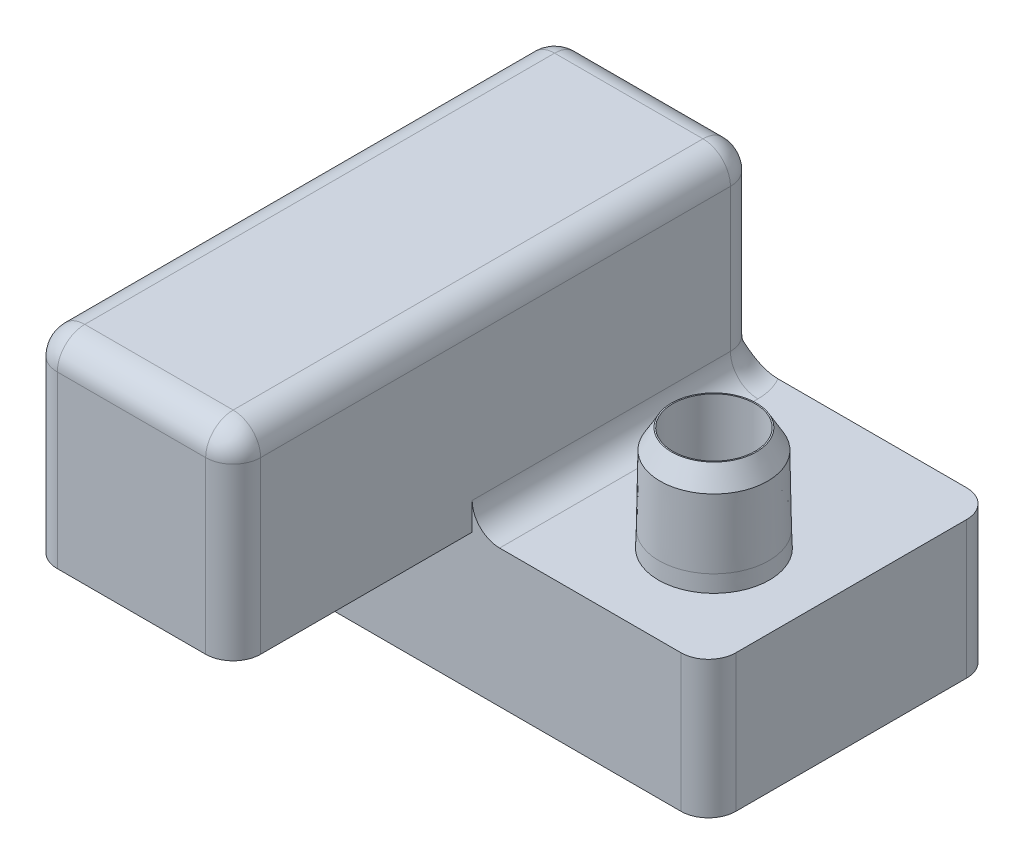
from build123d import *

# Parameters (mm, degrees)
SKETCH1_W               = 8
SKETCH1_H               = 5.2
SKETCH1_W_2             = 6.8
SKETCH1_H_2             = 4
BOSS_EXTRUDE1_DEPTH     = 2.5
SKETCH3_W               = 3.7
SKETCH3_H               = 9.55
SKETCH3_W_2             = 2.5
SKETCH3_H_2             = 8.35
BOSS_EXTRUDE2_DEPTH     = 3
SKETCH4_W               = 3.7
SKETCH4_H               = 4.95
BOSS_EXTRUDE3_DEPTH     = 0.6
SKETCH5_W               = 3.7
SKETCH5_H               = 9.55
BOSS_EXTRUDE4_DEPTH     = 0.6
SKETCH6_W               = 4.9
SKETCH6_H               = 5.2
BOSS_EXTRUDE5_DEPTH     = 0.6
FILLET2_R               = 0.7
SKETCH7_R               = 1
CUT_EXTRUDE1_DEPTH      = 4.5
CUT_EXTRUDE1_DRAFT      = -20
CUT_EXTRUDE3_REACH      = 10.671
SKETCH7_2_R             = 1
BOSS_EXTRUDE6_START     = -0.3
SKETCH8_R               = 1
BOSS_EXTRUDE6_DEPTH     = 1.6
BOSS_EXTRUDE6_DRAFT     = -1
CUT_EXTRUDE2_DEPTH      = 10.146720724
CUT_EXTRUDE2_DEPTH_BACK = 10.146720724
SKETCH9_R               = 0.75
FILLET3_R               = 0.5
FILLET5_R               = 0.5
FILLET6_R               = 0.5
CHAMFER1_SIZE           = 0.5
CHAMFER2_SIZE           = 0.2
CHAMFER2_SIZE2          = 0.357264117


# Read off the part's stored shape, not the designer's step: Boss-Extrude7
with BuildPart() as part:
    # Sketch1 → Boss-Extrude1 (new body)
    with BuildSketch(Plane(origin=(0, 0, 0), x_dir=(1, 0, 0), z_dir=(0, 1, 0))):
        Rectangle(SKETCH1_W, SKETCH1_H)
        Rectangle(SKETCH1_W_2, SKETCH1_H_2, mode=Mode.SUBTRACT)
    extrude(amount=BOSS_EXTRUDE1_DEPTH)

    # Sketch3 → Boss-Extrude2 (add)
    with BuildSketch(Plane(origin=(0, 2.5, 0), x_dir=(1, 0, 0), z_dir=(0, 1, 0))):
        with Locations((-2.15, -2.175)):
            Rectangle(SKETCH3_W, SKETCH3_H)
        with Locations((-2.15, -2.175)):
            Rectangle(SKETCH3_W_2, SKETCH3_H_2, mode=Mode.SUBTRACT)
    extrude(amount=BOSS_EXTRUDE2_DEPTH)

    # Sketch4 → Boss-Extrude3 (add)
    with BuildSketch(Plane.XZ.offset(-2.5)):
        with Locations((-2.15, 4.475)):
            Rectangle(SKETCH4_W, SKETCH4_H)
    extrude(amount=-BOSS_EXTRUDE3_DEPTH)

    # Sketch5 → Boss-Extrude4 (add)
    with BuildSketch(Plane(origin=(0, 5.5, 0), x_dir=(1, 0, 0), z_dir=(0, 1, 0))):
        with Locations((-2.15, -2.175)):
            Rectangle(SKETCH5_W, SKETCH5_H)
    extrude(amount=BOSS_EXTRUDE4_DEPTH)

    # Sketch6 → Boss-Extrude5 (add)
    with BuildSketch(Plane(origin=(0, 2.5, 0), x_dir=(1, 0, 0), z_dir=(0, 1, 0))):
        with Locations((1.55, 0)):
            Rectangle(SKETCH6_W, SKETCH6_H)
    extrude(amount=-BOSS_EXTRUDE5_DEPTH)

    # Fillet2
    fillet2_edges = [part.edges().sort_by_distance(p)[0] for p in [
        (-2.15, 5.5, -2),
        (-0.9, 5.5, 2.175),
        (-2.15, 5.5, 6.35),
        (-3.4, 5.5, 2.175),
    ]]
    fillet(fillet2_edges, radius=FILLET2_R)


with BuildPart() as cut_extrude1_tool:
    # Sketch7 → Cut-Extrude1 (with draft: the straight prism first)
    with BuildSketch(Plane.XZ.offset(-2.8)):
        with Locations((-2.15, 5.35)):
            Circle(SKETCH7_R)
    extrude(amount=CUT_EXTRUDE1_DEPTH)
    # Cut-Extrude1: the draft: its side faces are tilted about the plane it starts from
    cut_extrude1_sides = [cut_extrude1_tool.faces().sort_by_distance(p)[0] for p in [
        (-3.15, 0.55, 5.35),
    ]]
    draft(cut_extrude1_sides, Plane.XZ.offset(-2.8), CUT_EXTRUDE1_DRAFT)


with BuildPart() as part_1:
    add(part.part)

    # Cut-Extrude1: cut by cut_extrude1_tool
    add(cut_extrude1_tool.part, mode=Mode.SUBTRACT)

    # Sketch7<2> → Cut-Extrude3 (cut, up to next)
    with BuildSketch(Plane.XZ.offset(-2.8), mode=Mode.PRIVATE) as cut_extrude3_sk1:
        with Locations(Location((-2.15, 5.35, 0), (0, 0, 270))):
            Circle(SKETCH7_2_R)
    cut_extrude3_tool1 = extrude(cut_extrude3_sk1.sketch, amount=-CUT_EXTRUDE3_REACH, mode=Mode.PRIVATE) & part_1.part
    add(cut_extrude3_tool1.solids().sort_by_distance((-2.15, 2.8, 5.35))[0], mode=Mode.SUBTRACT)



with BuildPart() as body_2:
    # Sketch8 → Boss-Extrude6 (with draft: the straight prism first)
    with BuildSketch(Plane(origin=(0, 2.5, 0), x_dir=(-1, 0, 0), z_dir=(0, -1, 0)).offset(BOSS_EXTRUDE6_START)):
        with Locations((-2.15, -0.65)):
            Circle(SKETCH8_R)
    extrude(amount=-BOSS_EXTRUDE6_DEPTH)
    # Boss-Extrude6: the draft: its side faces are tilted about the plane it starts from
    boss_extrude6_sides = [body_2.faces().sort_by_distance(p)[0] for p in [
        (3.15, 3.6, 0.65),
    ]]
    draft(boss_extrude6_sides, Plane(origin=(0, 2.5, 0), x_dir=(-1, 0, 0), z_dir=(0, -1, 0)).offset(BOSS_EXTRUDE6_START), BOSS_EXTRUDE6_DRAFT)


with BuildPart() as part_2:
    add(part_1.part)

    add(body_2.part)  # Boss-Extrude7 merges body 2
    # Boss-Extrude7 outline → Boss-Extrude7 (revolve)
    with BuildSketch(Plane(origin=(2.15, 0, 0.65), x_dir=(1, 0, 0), z_dir=(0, 0, 1))):
        Polygon((1.010476231, 2.5), (1, 2.8), (0, 2.8), (0, 2.5), align=None)
    revolve(axis=Axis((2.15, 0, 0.65), (0, 1, 0)))

    # Sketch9 → Cut-Extrude2 (cut, two sides: drawn at the far end of the back side and taken through both)
    with BuildSketch(Plane(origin=(0, 4.4, 0), x_dir=(1, 0, 0), z_dir=(0, 1, 0)).offset(-CUT_EXTRUDE2_DEPTH_BACK)):
        with Locations(Location((2.15, -0.65, 0), (0, 0, 270))):
            Circle(SKETCH9_R)
    extrude(amount=CUT_EXTRUDE2_DEPTH + CUT_EXTRUDE2_DEPTH_BACK, mode=Mode.SUBTRACT)

    # Fillet3
    fillet3_edges = [part_2.edges().sort_by_distance(p)[0] for p in [
        (-4, 6.1, 2.175),
        (-2.15, 6.1, 6.95),
        (-0.3, 6.1, 2.175),
        (-2.15, 6.1, -2.6),
    ]]
    fillet(fillet3_edges, radius=FILLET3_R)

    # Fillet5
    # the kernel refuses this fillet: 0.5 mm, written as the material it takes off along each edge
    with BuildSketch(Plane(origin=(-0.8, 5.6, -2.1), x_dir=(1, 0, 0), z_dir=(0, 0, -1))) as fillet5_piece_1_section:
        Polygon((0, 0), (FILLET5_R, 0), (FILLET5_R, -FILLET5_R), (0, -FILLET5_R), align=None)
    fillet5_piece_1 = extrude(amount=FILLET5_R, mode=Mode.PRIVATE)
    fillet5_piece_1 = fillet5_piece_1 - Plane(origin=(-0.8, 5.6, -2.1), x_dir=(-0.7071067811865475, -0.7071067811865475, 0), z_dir=(0, 0, -1)) * Sphere(FILLET5_R, mode=Mode.PRIVATE)
    add(fillet5_piece_1, mode=Mode.SUBTRACT)
    with BuildSketch(Plane(origin=(-0.8, 5.6, 6.45), x_dir=(0, 0, 1), z_dir=(1, 0, 0))) as fillet5_piece_2_section:
        Polygon((0, 0), (FILLET5_R, 0), (FILLET5_R, -FILLET5_R), (0, -FILLET5_R), align=None)
    fillet5_piece_2 = extrude(amount=FILLET5_R, mode=Mode.PRIVATE)
    fillet5_piece_2 = fillet5_piece_2 - Plane(origin=(-0.8, 5.6, 6.45), x_dir=(0, -0.7071067811865475, -0.7071067811865475), z_dir=(1, 0, 0)) * Sphere(FILLET5_R, mode=Mode.PRIVATE)
    add(fillet5_piece_2, mode=Mode.SUBTRACT)
    with BuildSketch(Plane(origin=(-3.5, 5.6, -2.1), x_dir=(-1, 0, 0), z_dir=(0, 0, -1))) as fillet5_piece_3_section:
        Polygon((0, 0), (FILLET5_R, 0), (FILLET5_R, FILLET5_R), (0, FILLET5_R), align=None)
    fillet5_piece_3 = extrude(amount=FILLET5_R, mode=Mode.PRIVATE)
    fillet5_piece_3 = fillet5_piece_3 - Plane(origin=(-3.5, 5.6, -2.1), x_dir=(0.7071067811865475, -0.7071067811865475, 0), z_dir=(0, 0, -1)) * Sphere(FILLET5_R, mode=Mode.PRIVATE)
    add(fillet5_piece_3, mode=Mode.SUBTRACT)
    with BuildSketch(Plane(origin=(-3.5, 5.6, 6.45), x_dir=(0, 0, 1), z_dir=(-1, 0, 0))) as fillet5_piece_4_section:
        Polygon((0, 0), (FILLET5_R, 0), (FILLET5_R, FILLET5_R), (0, FILLET5_R), align=None)
    fillet5_piece_4 = extrude(amount=FILLET5_R, mode=Mode.PRIVATE)
    fillet5_piece_4 = fillet5_piece_4 - Plane(origin=(-3.5, 5.6, 6.45), x_dir=(0, -0.7071067811865475, -0.7071067811865475), z_dir=(-1, 0, 0)) * Sphere(FILLET5_R, mode=Mode.PRIVATE)
    add(fillet5_piece_4, mode=Mode.SUBTRACT)
    with BuildSketch(Plane(origin=(4, 3.75, 2.6), x_dir=(0, 0, -1), z_dir=(0, -1, 0)), Plane(origin=(4, 3.75, -2.6), x_dir=(-1, 0, 0), z_dir=(0, -1, 0))) as fillet5_piece_5:
        with BuildLine():
            CenterArc((FILLET5_R, -FILLET5_R), FILLET5_R, 90, 90)
            Line((0, -FILLET5_R), (0, 0))
            Line((0, 0), (FILLET5_R, 0))
        make_face()
    extrude(amount=5, mode=Mode.SUBTRACT)
    with BuildSketch(Plane(origin=(-4, 1.25, 6.95), x_dir=(0, 0, -1), z_dir=(0, 1, 0)), Plane(origin=(-0.3, 5.6, 6.95), x_dir=(0, 0, -1), z_dir=(0, -1, 0))) as fillet5_piece_6:
        with BuildLine():
            CenterArc((FILLET5_R, -FILLET5_R), FILLET5_R, 90, 90)
            Line((0, -FILLET5_R), (0, 0))
            Line((0, 0), (FILLET5_R, 0))
        make_face()
    extrude(amount=4.35, mode=Mode.SUBTRACT)
    with BuildSketch(Plane(origin=(-4, -1.25, -2.6), x_dir=(1, 0, 0), z_dir=(0, 1, 0))) as fillet5_piece_7:
        with BuildLine():
            CenterArc((FILLET5_R, -FILLET5_R), FILLET5_R, 90, 90)
            Line((0, -FILLET5_R), (0, 0))
            Line((0, 0), (FILLET5_R, 0))
        make_face()
    extrude(amount=6.85, mode=Mode.SUBTRACT)
    with BuildSketch(Plane(origin=(-0.3, 5.6, -2.6), x_dir=(-1, 0, 0), z_dir=(0, -1, 0))) as fillet5_piece_8:
        with BuildLine():
            CenterArc((FILLET5_R, -FILLET5_R), FILLET5_R, 90, 90)
            Line((0, -FILLET5_R), (0, 0))
            Line((0, 0), (FILLET5_R, 0))
        make_face()
    extrude(amount=3.1, mode=Mode.SUBTRACT)
    with BuildSketch(Plane(origin=(-4, -1.25, 2.6), x_dir=(0, 0, -1), z_dir=(0, 1, 0))) as fillet5_piece_9:
        with BuildLine():
            CenterArc((FILLET5_R, -FILLET5_R), FILLET5_R, 90, 90)
            Line((0, -FILLET5_R), (0, 0))
            Line((0, 0), (FILLET5_R, 0))
        make_face()
    extrude(amount=3.75, mode=Mode.SUBTRACT)

    # Fillet6
    # the kernel refuses this fillet: 0.5 mm, written as the material it adds along each edge
    with BuildSketch(Plane(origin=(-0.3, 2.5, 2.6), x_dir=(0, 1, 0), z_dir=(0, 0, -1))) as fillet6_piece_1:
        with BuildLine():
            CenterArc((FILLET6_R, FILLET6_R), FILLET6_R, 180, 90)
            Line((0, FILLET6_R), (0, 0))
            Line((0, 0), (FILLET6_R, 0))
        make_face()
    extrude(amount=4.7)
    with BuildSketch(Plane(origin=(-0.8, 2.5, -2.1), x_dir=(-0.5976672776328278, 0, 0.8017442392976482), z_dir=(0.8017442392976482, 0, 0.5976672776328278))) as fillet6_piece_2_section:
        with BuildLine():
            CenterArc((0.5 + FILLET6_R, -FILLET6_R), FILLET6_R, 90, 90)
            Line((0.5, -FILLET6_R), (0.5, 0))
            Line((0.5, 0), (0.5 + FILLET6_R, 0))
        make_face()
    fillet6_piece_2 = revolve(axis=Axis((-0.8, 2.5, -2.1), (0, -1, 0)), revolution_arc=233.296989237, mode=Mode.PRIVATE)
    fillet6_piece_2 = split(fillet6_piece_2, bisect_by=Plane(origin=(-0.425030478, 2.655814189, -2.6), z_dir=(0, 0, 1)), keep=Keep.TOP, mode=Mode.PRIVATE)
    fillet6_piece_2 = split(fillet6_piece_2, bisect_by=Plane(origin=(-0.425030478, 2.655814189, -2), z_dir=(0, 0, -1)), keep=Keep.TOP, mode=Mode.PRIVATE)
    add(fillet6_piece_2)

    # Chamfer1
    chamfer1_edges = [part_2.edges().sort_by_distance(p)[0] for p in [
        (-2.15, 3.1, 2),
    ]]
    chamfer(chamfer1_edges, length=CHAMFER1_SIZE)

    # Chamfer2
    chamfer2_edges = [part_2.edges().sort_by_distance(p)[0] for p in [
        (3.122071896, 4.4, 0.65),
    ]]
    chamfer2_side = [part_2.faces().sort_by_distance(p)[0] for p in [
        (3.094577551, 4.4, 0.65),
    ]]
    chamfer(chamfer2_edges, length=CHAMFER2_SIZE, length2=CHAMFER2_SIZE2, reference=chamfer2_side[0])


solid = part_2.part
